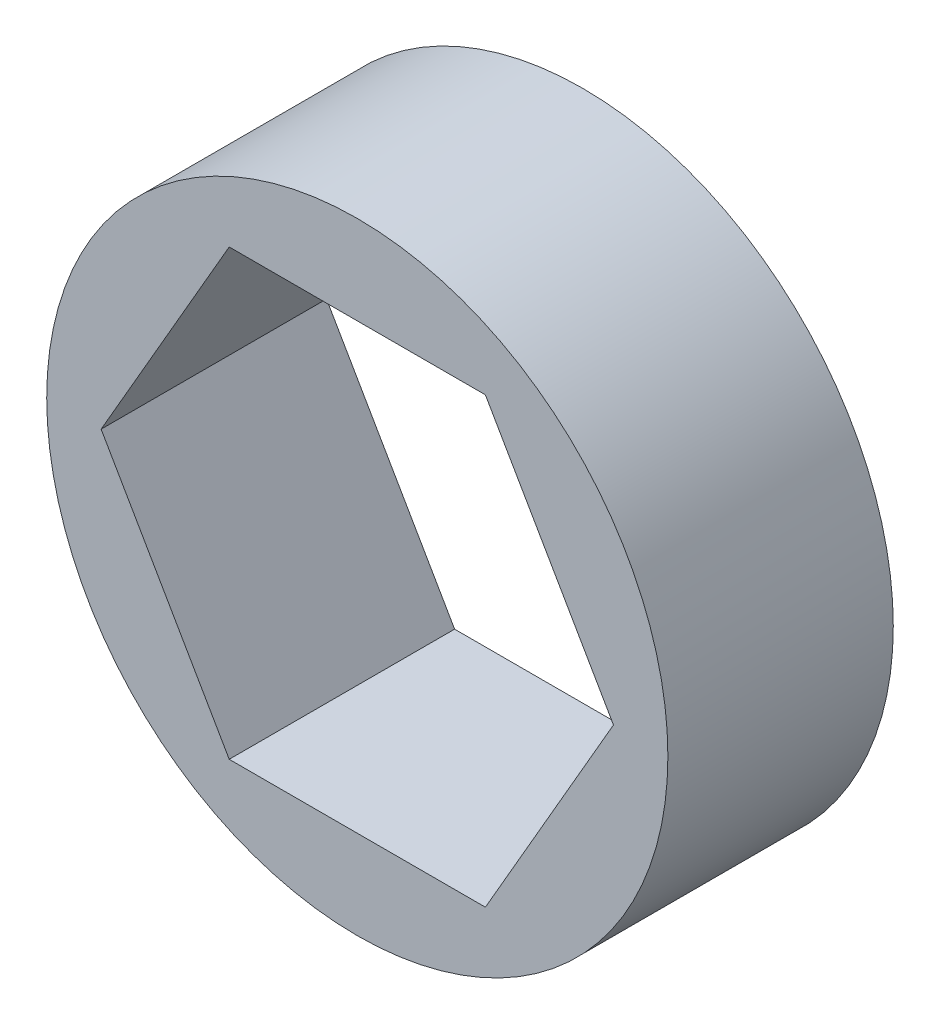
from build123d import *

# Parameters (mm, degrees)
SKETCH1_R           = 8.89
BOSS_EXTRUDE1_DEPTH = 3.2258


with BuildPart() as part:
    # Sketch1 → Boss-Extrude1 (new, symmetric)
    with BuildSketch(Plane.XY):
        Circle(SKETCH1_R)
        Polygon((-7.332348419, 0), (-3.666174209, -6.35), (3.666174209, -6.35), (7.332348419, 0), (3.666174209, 6.35), (-3.666174209, 6.35), align=None, mode=Mode.SUBTRACT)
    extrude(amount=BOSS_EXTRUDE1_DEPTH, both=True)


solid = part.part
